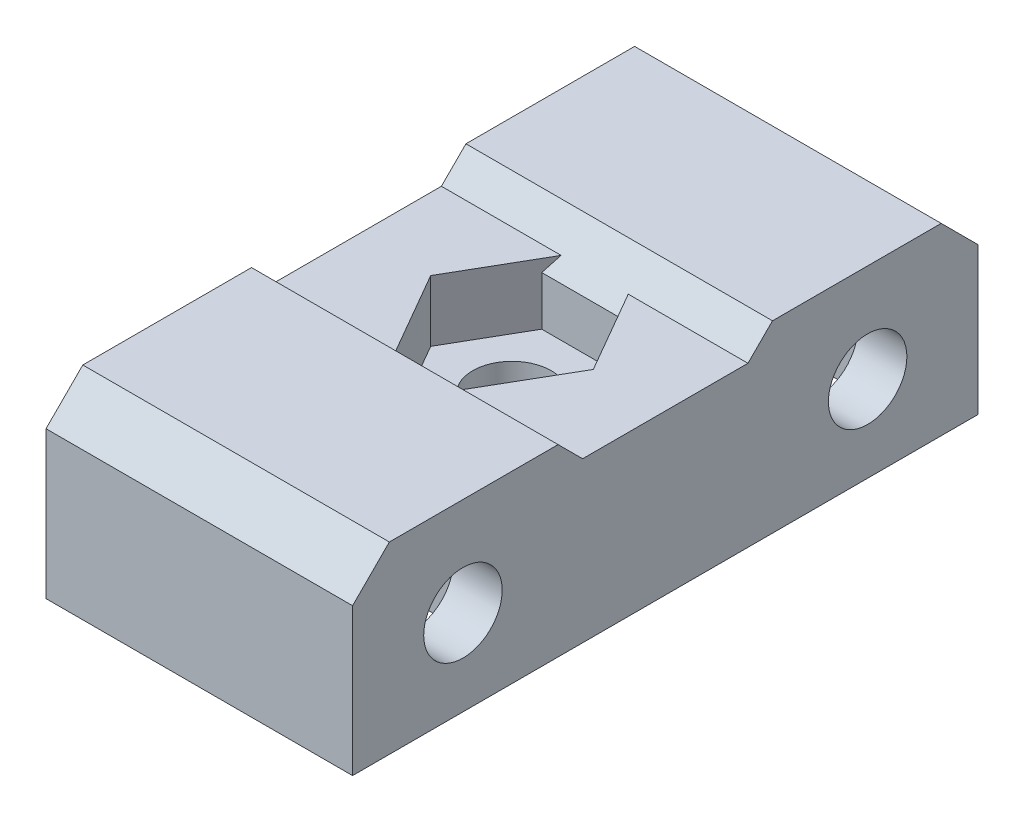
from build123d import *

# Parameters (mm, degrees)
SKETCH1_W                    = 25
SKETCH1_H                    = 45
BOSS_EXTRUDE1_DEPTH          = 12
CUT_EXTRUDE1_DEPTH           = 5
SKETCH3_R                    = 3.2
CUT_EXTRUDE2_DEPTH           = 27.673957337
SKETCH8_R                    = 3.2
CUT_EXTRUDE5_DEPTH           = 36.710642671
SKETCH9_W                    = 25
SKETCH9_H                    = 16.758251573
BOSS_EXTRUDE2_DEPTH          = 2
SKETCH12_W                   = 6.1
SKETCH12_H                   = 11.5
CUT_EXTRUDE6_DEPTH           = 12.5
CHAMFER1_SIZE                = 5
CHAMFER1_SIZE2               = 2.886751346
SKETCH14_W                   = 25
SKETCH14_H                   = 14
BOSS_EXTRUDE3_DEPTH          = 3
CHAMFER1_OF_MIRROR2_SIZE2    = 5
CHAMFER1_OF_MIRROR2_SIZE     = 2.886751346
MIRROR3_START                = -8.5
MIRROR3_OUTLINE_R            = 3.2
MIRROR3_DEPTH                = 6.1
MIRROR3_START_2              = 2.4
MIRROR3_2_OUTLINE_R          = 3.2
MIRROR3_2_DEPTH              = 6.1
MIRROR3_START_3              = -12.5
MIRROR3_3_DEPTH              = 25
MIRROR3_START_4              = -2.4
MIRROR3_4_DEPTH              = 4.8
MIRROR3_5_DEPTH              = 4
MIRROR3_START_5              = 8.5
MIRROR3_6_DEPTH              = 4
CHAMFER2_SIZE                = 3
SKETCH17_W                   = 25
SKETCH17_H                   = 51
SKETCH17_R                   = 3.2
SKETCH17_W_2                 = 6.1
SKETCH17_H_2                 = 11.5
EXTRA_1MM_BASE_EXTRUDE_DEPTH = 1


# Read off the part's stored shape, not the designer's step: Mirror3
with BuildPart() as part:
    # Sketch1 → Boss-Extrude1 (new body)
    with BuildSketch(Plane(origin=(0, 0, 0), x_dir=(1, 0, 0), z_dir=(0, 1, 0))):
        Rectangle(SKETCH1_W, SKETCH1_H)
    extrude(amount=BOSS_EXTRUDE1_DEPTH)

    # Sketch2 → Cut-Extrude1 (cut)
    with BuildSketch(Plane(origin=(0, 12, 0), x_dir=(1, 0, 0), z_dir=(0, 1, 0))):
        Polygon((3.315, -5.741748427), (6.63, 0), (3.315, 5.741748427), (-3.315, 5.741748427), (-6.63, 0), (-3.315, -5.741748427), align=None)
    extrude(amount=-CUT_EXTRUDE1_DEPTH, mode=Mode.SUBTRACT)

    # Sketch3 → Cut-Extrude2 (cut, through all)
    with BuildSketch(Plane(origin=(0, 7, 0), x_dir=(1, 0, 0), z_dir=(0, 1, 0))):
        with Locations(Location((0, 0, 0), (0, 0, 270))):
            Circle(SKETCH3_R)
    extrude(amount=-CUT_EXTRUDE2_DEPTH, mode=Mode.SUBTRACT)

    # Sketch8 → Cut-Extrude5 (cut, through all)
    with BuildSketch(Plane.ZY.offset(12.5)):
        with Locations((16.5, 6)):
            Circle(SKETCH8_R)
    cut_extrude5 = extrude(amount=-CUT_EXTRUDE5_DEPTH, mode=Mode.SUBTRACT)

    # Mirror1: Cut-Extrude5 across plane
    add(cut_extrude5.mirror(Plane.XY), mode=Mode.SUBTRACT)

    # Sketch9 → Boss-Extrude2 (add)
    with BuildSketch(Plane(origin=(0, 12, 0), x_dir=(1, 0, 0), z_dir=(0, 1, 0))):
        with Locations((0, 14.120874214)):
            Rectangle(SKETCH9_W, SKETCH9_H)
    extrude(amount=BOSS_EXTRUDE2_DEPTH)

    # Sketch12 → Cut-Extrude6 (cut)
    with BuildSketch(Plane(origin=(0, 0, 0), x_dir=(1, 0, 0), z_dir=(0, 1, 0))):
        with Locations((-5.45, 16.5)):
            Rectangle(SKETCH12_W, SKETCH12_H)
    cut_extrude6 = extrude(amount=CUT_EXTRUDE6_DEPTH, mode=Mode.SUBTRACT)

    # Chamfer1
    chamfer1_edges = [part.edges().sort_by_distance(p)[0] for p in [
        (-5.45, 12.5, -10.75),
        (-5.45, 12.5, -22.25),
    ]]
    chamfer1_side = [part.faces().sort_by_distance(p)[0] for p in [
        (-5.45, 12.5, -16.5),
    ]]
    chamfer(chamfer1_edges, length=CHAMFER1_SIZE, length2=CHAMFER1_SIZE2, reference=chamfer1_side[0])

    # Sketch14 → Boss-Extrude3 (add)
    with BuildSketch(Plane(origin=(0, 0, -22.5), x_dir=(-1, 0, 0), z_dir=(0, 0, -1))):
        with Locations((0, 7)):
            Rectangle(SKETCH14_W, SKETCH14_H)
    extrude(amount=BOSS_EXTRUDE3_DEPTH)

    # Mirror2: Cut-Extrude6 across plane
    add(cut_extrude6.mirror(Plane(origin=(0, 0, 0), x_dir=(0, 0, 1), z_dir=(1, 0, 0))), mode=Mode.SUBTRACT)

    # Chamfer1 of Mirror2
    chamfer1_of_mirror2_edges = [part.edges().sort_by_distance(p)[0] for p in [
        (5.45, 12.5, -10.75),
        (5.45, 12.5, -22.25),
    ]]
    chamfer(chamfer1_of_mirror2_edges, length=CHAMFER1_OF_MIRROR2_SIZE, length2=CHAMFER1_OF_MIRROR2_SIZE2)

    # Mirror3 outline → Mirror3 (cut)
    with BuildSketch(Plane.YZ.offset(MIRROR3_START)):
        Polygon((9.613248654, 10.75), (12, 14.883974596), (12, 18.116025404), (9.613248654, 22.25), (0, 22.25), (0, 10.75), align=None)
        with Locations((6, 16.5)):
            Circle(MIRROR3_OUTLINE_R, mode=Mode.SUBTRACT)
    extrude(amount=MIRROR3_DEPTH, mode=Mode.SUBTRACT)

    # Mirror3 2 outline → Mirror3 2 (cut)
    with BuildSketch(Plane.YZ.offset(MIRROR3_START_2)):
        Polygon((9.613248654, 10.75), (12, 14.883974596), (12, 18.116025404), (9.613248654, 22.25), (0, 22.25), (0, 10.75), align=None)
        with Locations((6, 16.5)):
            Circle(MIRROR3_2_OUTLINE_R, mode=Mode.SUBTRACT)
    extrude(amount=MIRROR3_2_DEPTH, mode=Mode.SUBTRACT)

    # Mirror3 3 outline → Mirror3 3 (add)
    with BuildSketch(Plane.YZ.offset(MIRROR3_START_3)):
        Polygon((12, 5.741748427), (14, 5.741748427), (14, 25.5), (0, 25.5), (0, 22.5), (12, 22.5), (12, 18.116025404), (12.5, 17.25), (12.5, 15.75), (12, 14.883974596), align=None)
    extrude(amount=MIRROR3_3_DEPTH)

    # Mirror3 4 outline → Mirror3 4 (add)
    with BuildSketch(Plane.YZ.offset(MIRROR3_START_4)):
        Polygon((12, 18.116025404), (12, 14.883974596), (12.5, 15.75), (12.5, 17.25), align=None)
    extrude(amount=MIRROR3_4_DEPTH)

    # Mirror3 5 outline → Mirror3 5 (add)
    with BuildSketch(Plane.YZ.offset(MIRROR3_START_3)):
        Polygon((12, 18.116025404), (12, 14.883974596), (12.5, 15.75), (12.5, 17.25), align=None)
    extrude(amount=MIRROR3_5_DEPTH)

    # Mirror3 6 outline → Mirror3 6 (add)
    with BuildSketch(Plane.YZ.offset(MIRROR3_START_5)):
        Polygon((12, 18.116025404), (12, 14.883974596), (12.5, 15.75), (12.5, 17.25), align=None)
    extrude(amount=MIRROR3_6_DEPTH)

    # Chamfer2
    # the kernel refuses this chamfer: 3 mm, written as the material it takes off along each edge
    with BuildSketch(Plane(origin=(20.215048964, 14, -5.741748427), x_dir=(0, -0.9996219169112969, 0.027495876610586497), z_dir=(-1, 0, 0))) as chamfer2_piece_1_section:
        Polygon((CHAMFER2_SIZE * 0.999621916911, -CHAMFER2_SIZE * 0.0274958766106), (-CHAMFER2_SIZE * 0.0274958766106, -CHAMFER2_SIZE * 0.999621916911), (0, 0), align=None)
    chamfer2_piece_1 = extrude(amount=40.430097928, mode=Mode.PRIVATE)
    chamfer2_piece_1 = split(chamfer2_piece_1, bisect_by=Plane(origin=(11.444466888, 12, -6.852192504), z_dir=(0, 1, 0)), keep=Keep.TOP, mode=Mode.PRIVATE)
    chamfer2_piece_1 = split(chamfer2_piece_1, bisect_by=Plane(origin=(4.866530332, 13.212813285, -3.054419063), z_dir=(0.8660254037844385, 0, -0.5000000000000003)), keep=Keep.TOP, mode=Mode.PRIVATE)
    add(chamfer2_piece_1, mode=Mode.SUBTRACT)
    with BuildSketch(Plane(origin=(20.215048964, 14, -5.741748427), x_dir=(0, -0.9996219169112969, 0.027495876610586497), z_dir=(-1, 0, 0))) as chamfer2_piece_2_section:
        Polygon((CHAMFER2_SIZE * 0.999621916911, -CHAMFER2_SIZE * 0.0274958766106), (-CHAMFER2_SIZE * 0.0274958766106, -CHAMFER2_SIZE * 0.999621916911), (0, 0), align=None)
    chamfer2_piece_2 = extrude(amount=40.430097928, mode=Mode.PRIVATE)
    chamfer2_piece_2 = split(chamfer2_piece_2, bisect_by=Plane(origin=(0, 12, -5.991035204), z_dir=(0, -1, 0)), keep=Keep.TOP, mode=Mode.PRIVATE)
    chamfer2_piece_2 = split(chamfer2_piece_2, bisect_by=Plane(origin=(-2.378305659, 11.613346541, -7.364150617), z_dir=(0.8660254037844387, 0, 0.5000000000000001)), keep=Keep.TOP, mode=Mode.PRIVATE)
    chamfer2_piece_2 = split(chamfer2_piece_2, bisect_by=Plane(origin=(2.378305659, 11.613346541, -7.364150617), z_dir=(-0.8660254037844385, 0, 0.5000000000000003)), keep=Keep.TOP, mode=Mode.PRIVATE)
    add(chamfer2_piece_2, mode=Mode.SUBTRACT)
    with BuildSketch(Plane(origin=(20.215048964, 14, -5.741748427), x_dir=(0, -0.9996219169112969, 0.027495876610586497), z_dir=(-1, 0, 0))) as chamfer2_piece_3_section:
        Polygon((CHAMFER2_SIZE * 0.999621916911, -CHAMFER2_SIZE * 0.0274958766106), (-CHAMFER2_SIZE * 0.0274958766106, -CHAMFER2_SIZE * 0.999621916911), (0, 0), align=None)
    chamfer2_piece_3 = extrude(amount=40.430097928, mode=Mode.PRIVATE)
    chamfer2_piece_3 = split(chamfer2_piece_3, bisect_by=Plane(origin=(0, 12, -6.713987666), z_dir=(0, 1, 0)), keep=Keep.TOP, mode=Mode.PRIVATE)
    chamfer2_piece_3 = split(chamfer2_piece_3, bisect_by=Plane(origin=(-2.06525806, 13.168089522, -7.906364963), z_dir=(0.8660254037844387, 0, 0.5000000000000001)), keep=Keep.TOP, mode=Mode.PRIVATE)
    chamfer2_piece_3 = split(chamfer2_piece_3, bisect_by=Plane(origin=(2.06525806, 13.168089522, -7.906364963), z_dir=(-0.8660254037844385, 0, 0.5000000000000003)), keep=Keep.TOP, mode=Mode.PRIVATE)
    add(chamfer2_piece_3, mode=Mode.SUBTRACT)
    with BuildSketch(Plane(origin=(20.215048964, 14, -5.741748427), x_dir=(0, -0.9996219169112969, 0.027495876610586497), z_dir=(-1, 0, 0))) as chamfer2_piece_4_section:
        Polygon((CHAMFER2_SIZE * 0.999621916911, -CHAMFER2_SIZE * 0.0274958766106), (-CHAMFER2_SIZE * 0.0274958766106, -CHAMFER2_SIZE * 0.999621916911), (0, 0), align=None)
    chamfer2_piece_4 = extrude(amount=40.430097928, mode=Mode.PRIVATE)
    chamfer2_piece_4 = split(chamfer2_piece_4, bisect_by=Plane(origin=(-11.444466888, 12, -6.852192504), z_dir=(0, 1, 0)), keep=Keep.TOP, mode=Mode.PRIVATE)
    chamfer2_piece_4 = split(chamfer2_piece_4, bisect_by=Plane(origin=(-4.866530332, 13.212813285, -3.054419063), z_dir=(-0.8660254037844387, 0, -0.5000000000000001)), keep=Keep.TOP, mode=Mode.PRIVATE)
    add(chamfer2_piece_4, mode=Mode.SUBTRACT)
    with BuildSketch(Plane(origin=(-20.215048964, 14, 25.5), x_dir=(0, -0.9996219169112968, 0.02749587661058678), z_dir=(1, 0, 0)), Plane(origin=(20.215048964, 14, -25.5), x_dir=(0, -0.9996219169112968, -0.02749587661058678), z_dir=(-1, 0, 0))) as chamfer2_piece_5:
        Polygon((CHAMFER2_SIZE * 0.999621916911, CHAMFER2_SIZE * 0.0274958766106), (-CHAMFER2_SIZE * 0.0274958766106, CHAMFER2_SIZE * 0.999621916911), (0, 0), align=None)
    extrude(amount=40.430097928, mode=Mode.SUBTRACT)
    with BuildSketch(Plane(origin=(-20.215048964, 14, 5.741748427), x_dir=(0, -0.9996219169112969, -0.027495876610586497), z_dir=(1, 0, 0))) as chamfer2_piece_6_section:
        Polygon((CHAMFER2_SIZE * 0.999621916911, -CHAMFER2_SIZE * 0.0274958766106), (-CHAMFER2_SIZE * 0.0274958766106, -CHAMFER2_SIZE * 0.999621916911), (0, 0), align=None)
    chamfer2_piece_6 = extrude(amount=40.430097928, mode=Mode.PRIVATE)
    chamfer2_piece_6 = split(chamfer2_piece_6, bisect_by=Plane(origin=(-11.444466888, 12, 6.852192504), z_dir=(0, 1, 0)), keep=Keep.TOP, mode=Mode.PRIVATE)
    chamfer2_piece_6 = split(chamfer2_piece_6, bisect_by=Plane(origin=(-4.866530332, 13.212813285, 3.054419063), z_dir=(-0.8660254037844385, 0, 0.5000000000000004)), keep=Keep.TOP, mode=Mode.PRIVATE)
    add(chamfer2_piece_6, mode=Mode.SUBTRACT)
    with BuildSketch(Plane(origin=(-20.215048964, 14, 5.741748427), x_dir=(0, -0.9996219169112969, -0.027495876610586497), z_dir=(1, 0, 0))) as chamfer2_piece_7_section:
        Polygon((CHAMFER2_SIZE * 0.999621916911, -CHAMFER2_SIZE * 0.0274958766106), (-CHAMFER2_SIZE * 0.0274958766106, -CHAMFER2_SIZE * 0.999621916911), (0, 0), align=None)
    chamfer2_piece_7 = extrude(amount=40.430097928, mode=Mode.PRIVATE)
    chamfer2_piece_7 = split(chamfer2_piece_7, bisect_by=Plane(origin=(0, 12, 5.991035204), z_dir=(0, -1, 0)), keep=Keep.TOP, mode=Mode.PRIVATE)
    chamfer2_piece_7 = split(chamfer2_piece_7, bisect_by=Plane(origin=(-2.378305659, 11.613346541, 7.364150617), z_dir=(0.8660254037844385, 0, -0.5000000000000004)), keep=Keep.TOP, mode=Mode.PRIVATE)
    chamfer2_piece_7 = split(chamfer2_piece_7, bisect_by=Plane(origin=(2.378305659, 11.613346541, 7.364150617), z_dir=(-0.8660254037844385, 0, -0.5000000000000004)), keep=Keep.TOP, mode=Mode.PRIVATE)
    add(chamfer2_piece_7, mode=Mode.SUBTRACT)
    with BuildSketch(Plane(origin=(-20.215048964, 14, 5.741748427), x_dir=(0, -0.9996219169112969, -0.027495876610586497), z_dir=(1, 0, 0))) as chamfer2_piece_8_section:
        Polygon((CHAMFER2_SIZE * 0.999621916911, -CHAMFER2_SIZE * 0.0274958766106), (-CHAMFER2_SIZE * 0.0274958766106, -CHAMFER2_SIZE * 0.999621916911), (0, 0), align=None)
    chamfer2_piece_8 = extrude(amount=40.430097928, mode=Mode.PRIVATE)
    chamfer2_piece_8 = split(chamfer2_piece_8, bisect_by=Plane(origin=(0, 12, 6.713987666), z_dir=(0, 1, 0)), keep=Keep.TOP, mode=Mode.PRIVATE)
    chamfer2_piece_8 = split(chamfer2_piece_8, bisect_by=Plane(origin=(-2.06525806, 13.168089522, 7.906364963), z_dir=(0.8660254037844385, 0, -0.5000000000000004)), keep=Keep.TOP, mode=Mode.PRIVATE)
    chamfer2_piece_8 = split(chamfer2_piece_8, bisect_by=Plane(origin=(2.06525806, 13.168089522, 7.906364963), z_dir=(-0.8660254037844385, 0, -0.5000000000000004)), keep=Keep.TOP, mode=Mode.PRIVATE)
    add(chamfer2_piece_8, mode=Mode.SUBTRACT)
    with BuildSketch(Plane(origin=(-20.215048964, 14, 5.741748427), x_dir=(0, -0.9996219169112969, -0.027495876610586497), z_dir=(1, 0, 0))) as chamfer2_piece_9_section:
        Polygon((CHAMFER2_SIZE * 0.999621916911, -CHAMFER2_SIZE * 0.0274958766106), (-CHAMFER2_SIZE * 0.0274958766106, -CHAMFER2_SIZE * 0.999621916911), (0, 0), align=None)
    chamfer2_piece_9 = extrude(amount=40.430097928, mode=Mode.PRIVATE)
    chamfer2_piece_9 = split(chamfer2_piece_9, bisect_by=Plane(origin=(11.444466888, 12, 6.852192504), z_dir=(0, 1, 0)), keep=Keep.TOP, mode=Mode.PRIVATE)
    chamfer2_piece_9 = split(chamfer2_piece_9, bisect_by=Plane(origin=(4.866530332, 13.212813285, 3.054419063), z_dir=(0.8660254037844385, 0, 0.5000000000000004)), keep=Keep.TOP, mode=Mode.PRIVATE)
    add(chamfer2_piece_9, mode=Mode.SUBTRACT)

    # Sketch17 → Extra 1mm base extrude (add)
    with BuildSketch(Plane.XZ):
        Rectangle(SKETCH17_W, SKETCH17_H)
        with Locations(Location((0, 0, 0), (0, 0, 90))):
            Circle(SKETCH17_R, mode=Mode.SUBTRACT)
        with Locations((-5.45, 16.5)):
            Rectangle(SKETCH17_W_2, SKETCH17_H_2, mode=Mode.SUBTRACT)
        with Locations((5.45, 16.5)):
            Rectangle(SKETCH17_W_2, SKETCH17_H_2, mode=Mode.SUBTRACT)
        with Locations((5.45, -16.5)):
            Rectangle(SKETCH17_W_2, SKETCH17_H_2, mode=Mode.SUBTRACT)
        with Locations((-5.45, -16.5)):
            Rectangle(SKETCH17_W_2, SKETCH17_H_2, mode=Mode.SUBTRACT)
    extrude(amount=EXTRA_1MM_BASE_EXTRUDE_DEPTH)


solid = part.part
